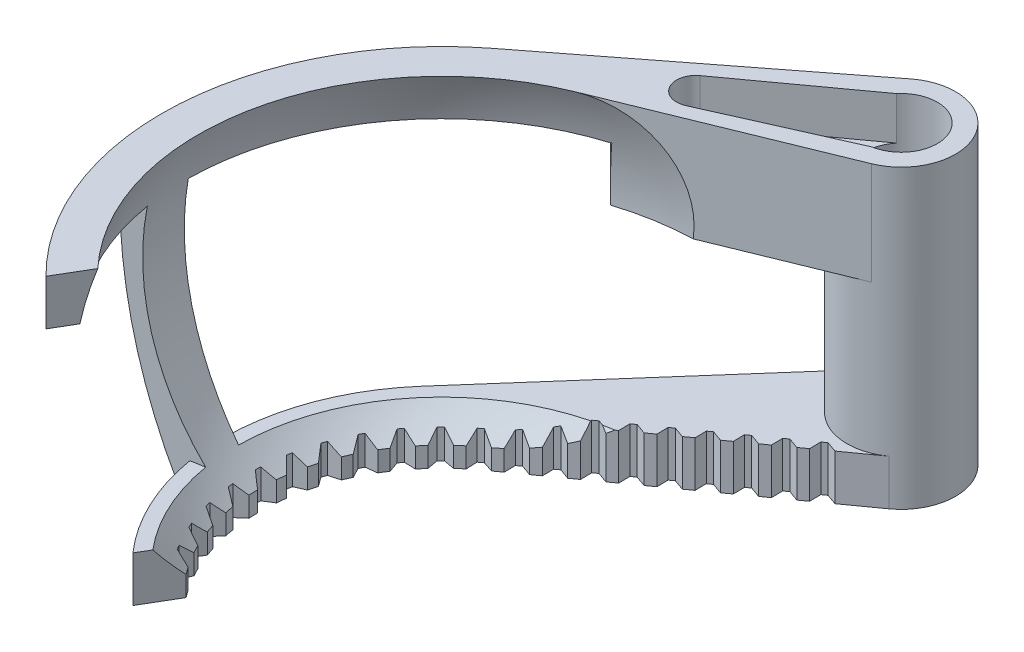
from build123d import *
from build123d.topology import SkipClean

# Parameters (mm, degrees)
BOSS_EXTRUDE1_START       = -4.7
BOSS_EXTRUDE1_DEPTH       = 4.7
BOSS_EXTRUDE2_OUTLINE_R   = 0.75
BOSS_EXTRUDE2_OUTLINE_R_2 = 2.5
BOSS_EXTRUDE2_DEPTH       = 0.3
SKETCH1_9_R               = 3.95
CUT_EXTRUDE2_DEPTH        = 0.7
SKETCH6_R                 = 0.75
SKETCH6_R_2               = 3.95
BOSS_EXTRUDE6_DEPTH       = 6.25
BOSS_EXTRUDE3_START       = 6.25
SKETCH2_R                 = 5.95
SKETCH2_R_2               = 4.2
BOSS_EXTRUDE3_DEPTH       = 16.25
SKETCH4_R                 = 5.95
SKETCH4_R_2               = 4.2
BOSS_EXTRUDE5_DEPTH       = 5
REVOLVE1_ANGLE            = 10
CUT_EXTRUDE3_DEPTH        = 79.445410831
CIRPATTERN1_COUNT         = 11
CIRPATTERN1_ANGLE         = 85
CUT_EXTRUDE4_DEPTH        = 79.445410831
LPATTERN1_COUNT           = 9
LPATTERN1_PITCH           = 3


# Read off the part's stored shape, not the designer's step: Boss-Extrude2
with BuildPart() as part:
    # Sketch1 → Boss-Extrude1 (new body)
    with BuildSketch(Plane.XZ.offset(-23.543068193).offset(BOSS_EXTRUDE1_START)):
        with BuildLine():
            Line((-0.472592015, 60.640230135), (-2.578285997, 64.210446846))
            ThreePointArc((-2.578285997, 64.210446846), (-11.633365316, 40.543634759), (0.19757138, 18.135123145))
            Line((0.19757138, 18.135123145), (26.104084692, -1.947430003))
            ThreePointArc((26.104084692, -1.947430003), (34.902992649, -0.218708783), (31.996731648, 8.264386483))
            Line((31.996731648, 8.264386483), (8.919209653, 17.677874535))
            ThreePointArc((8.919209653, 17.677874535), (-7.073200942, 36.689574632), (-0.472592015, 60.640230135))
        make_face()
        with BuildLine():
            ThreePointArc((14.223692018, 9.302922077), (13.639231125, 12.051374585), (16.311289521, 12.920678706))
            Line((16.311289521, 12.920678706), (30.419933466, 6.647779521))
            ThreePointArc((30.419933466, 6.647779521), (32.770289273, 5.300105007), (33.699453705, 2.75509961))
            ThreePointArc((33.699453705, 2.75509961), (31.093930231, -0.959046708), (26.714702885, 0.226703387))
            Line((26.714702885, 0.226703387), (14.223692018, 9.302922077))
        make_face(mode=Mode.SUBTRACT)
    extrude(amount=BOSS_EXTRUDE1_DEPTH)

    # Boss-Extrude2 outline → Boss-Extrude2 (add)
    with BuildSketch(Plane.XZ.offset(-23.543068193)):
        with BuildLine():
            Line((-0.472592015, 60.640230135), (-2.578285997, 64.210446846))
            ThreePointArc((-2.578285997, 64.210446846), (-11.633365316, 40.543634759), (0.19757138, 18.135123145))
            Line((0.19757138, 18.135123145), (26.104084692, -1.947430003))
            ThreePointArc((26.104084692, -1.947430003), (34.902992649, -0.218708783), (31.996731648, 8.264386483))
            Line((31.996731648, 8.264386483), (8.919209653, 17.677874535))
            ThreePointArc((8.919209653, 17.677874535), (-7.073200942, 36.689574632), (-0.472592015, 60.640230135))
        make_face()
        with Locations((15.025056724, 11.251695017)):
            Circle(BOSS_EXTRUDE2_OUTLINE_R, mode=Mode.SUBTRACT)
        with Locations((16.757338721, 10.252095558)):
            Circle(BOSS_EXTRUDE2_OUTLINE_R, mode=Mode.SUBTRACT)
        with Locations((18.489620719, 9.252496098)):
            Circle(BOSS_EXTRUDE2_OUTLINE_R, mode=Mode.SUBTRACT)
        with Locations((20.221902717, 8.252896638)):
            Circle(BOSS_EXTRUDE2_OUTLINE_R, mode=Mode.SUBTRACT)
        with Locations((21.954184715, 7.253297178)):
            Circle(BOSS_EXTRUDE2_OUTLINE_R, mode=Mode.SUBTRACT)
        with Locations((23.686466713, 6.253697719)):
            Circle(BOSS_EXTRUDE2_OUTLINE_R, mode=Mode.SUBTRACT)
        with Locations((29.749453705, 2.75509961)):
            Circle(BOSS_EXTRUDE2_OUTLINE_R_2, mode=Mode.SUBTRACT)
        with Locations((25.418748711, 5.254098259)):
            Circle(BOSS_EXTRUDE2_OUTLINE_R, mode=Mode.SUBTRACT)
    extrude(amount=BOSS_EXTRUDE2_DEPTH)

    # Sketch1<9> → Cut-Extrude2 (cut)
    with SkipClean():  # the faces are left unmerged after this step: merging them gives an invalid solid
        with BuildSketch(Plane.XZ.offset(-23.543068193)):
            with Locations(Location((29.749453705, 2.75509961, 0), (0, 0, 270))):
                Circle(SKETCH1_9_R)
        extrude(amount=CUT_EXTRUDE2_DEPTH, mode=Mode.SUBTRACT)

    # Sketch6 → Boss-Extrude6 (add)
    with SkipClean():  # the faces are left unmerged after this step: merging them gives an invalid solid
        with BuildSketch(Plane.XZ.offset(-23.243068193)):
            with BuildLine():
                Line((31.996731648, 8.264386483), (13.649275404, 15.748446521))
                ThreePointArc((13.649275404, 15.748446521), (9.622827675, 14.369008044), (10.443354312, 10.192661811))
                Line((10.443354312, 10.192661811), (26.104084692, -1.947430003))
                ThreePointArc((26.104084692, -1.947430003), (34.902992649, -0.218708783), (31.996731648, 8.264386483))
            make_face()
            with Locations((15.025056724, 11.251695017)):
                Circle(SKETCH6_R, mode=Mode.SUBTRACT)
            with Locations((16.757338721, 10.252095558)):
                Circle(SKETCH6_R, mode=Mode.SUBTRACT)
            with Locations((18.489620719, 9.252496098)):
                Circle(SKETCH6_R, mode=Mode.SUBTRACT)
            with Locations((20.221902717, 8.252896638)):
                Circle(SKETCH6_R, mode=Mode.SUBTRACT)
            with Locations((21.954184715, 7.253297178)):
                Circle(SKETCH6_R, mode=Mode.SUBTRACT)
            with Locations((23.686466713, 6.253697719)):
                Circle(SKETCH6_R, mode=Mode.SUBTRACT)
            with Locations((29.749453705, 2.75509961)):
                Circle(SKETCH6_R_2, mode=Mode.SUBTRACT)
            with Locations((25.418748711, 5.254098259)):
                Circle(SKETCH6_R, mode=Mode.SUBTRACT)
        extrude(amount=BOSS_EXTRUDE6_DEPTH)

    # Sketch2 → Boss-Extrude3 (add)
    with SkipClean():  # the faces are left unmerged after this step: merging them gives an invalid solid
        with BuildSketch(Plane.XZ.offset(-23.243068193).offset(BOSS_EXTRUDE3_START)):
            with Locations(Location((29.749453705, 2.75509961, 0), (0, 0, 232.217400312))):
                Circle(SKETCH2_R)
            with Locations((29.749453705, 2.75509961)):
                Circle(SKETCH2_R_2, mode=Mode.SUBTRACT)
        extrude(amount=BOSS_EXTRUDE3_DEPTH)

    # Sketch4 → Boss-Extrude5 (add)
    # profile 1 of 2: a face of its own
    with SkipClean():  # the faces are left unmerged after this step: merging them gives an invalid solid
        with BuildSketch(Plane.XZ.offset(-0.743068193)):
            with Locations(Location((29.749453705, 2.75509961, 0), (0, 0, 232.217400312))):
                Circle(SKETCH4_R)
            with Locations((29.749453705, 2.75509961)):
                Circle(SKETCH4_R_2, mode=Mode.SUBTRACT)
        # profile 2 of 2: a face of its own
        with BuildSketch(Plane.XZ.offset(-0.743068193)):
            with BuildLine():
                Line((33.215886618, 7.59104242), (7.347230343, 26.133850933))
                ThreePointArc((7.347230343, 26.133850933), (-0.783193574, 39.446224983), (3.120108256, 54.548785387))
                Line((3.120108256, 54.548785387), (0.957208419, 58.215994967))
                ThreePointArc((0.957208419, 58.215994967), (-5.00089426, 42.390828737), (0.954956103, 26.564814703))
                Line((0.954956103, 26.564814703), (25.27600829, -1.168009631))
                ThreePointArc((25.27600829, -1.168009631), (25.34107909, 6.751189354), (33.215886618, 7.59104242))
            make_face()
        extrude(amount=BOSS_EXTRUDE5_DEPTH)

    # Sketch5 → Cut-Revolve1 (revolve, cut)
    with SkipClean():  # the faces are left unmerged after this step: merging them gives an invalid solid
        with BuildSketch(Plane(origin=(7.392091837, 0, 44.324832913), x_dir=(-0.9863772479069666, 0, 0.1644990115820723), z_dir=(-0.1644990115820723, 1.1589156336199524e-15, -0.9863772479069666))):
            with BuildLine():
                ThreePointArc((16.732682915, 18.243068193), (8.385226178, 38.395611457), (-11.767317085, 46.743068193))
                Line((-11.767317085, 46.743068193), (-11.767317085, -10.256931807))
                ThreePointArc((-11.767317085, -10.256931807), (8.385226178, -1.909475071), (16.732682915, 18.243068193))
            make_face()
            with BuildLine():
                Line((-11.767317085, -10.256931807), (-11.767317085, 46.743068193))
                ThreePointArc((-11.767317085, 46.743068193), (-40.267317085, 18.243068193), (-11.767317085, -10.256931807))
            make_face()
        revolve(axis=Axis((18.999105679, 46.743068193, 42.389120883), (0, -1, 0)), mode=Mode.SUBTRACT)

    # Sketch9 → Revolve1 (revolve)
    with SkipClean():  # the faces are left unmerged after this step: merging them gives an invalid solid
        with BuildSketch(Plane(origin=(71.492081558, 0, 33.634820573), x_dir=(0.9863772479069666, 0, -0.1644990115820723), z_dir=(0.1644990115820723, -1.1589156336199524e-15, 0.9863772479069666))):
            with BuildLine():
                Line((-81.275926524, 23.243068193), (-83.905963121, 23.243068193))
                ThreePointArc((-83.905963121, 23.243068193), (-82.209941974, 9.092277505), (-77.21795083, -4.256931807))
                Line((-77.21795083, -4.256931807), (-77.21795083, 0.743068193))
                Line((-77.21795083, 0.743068193), (-75.712394589, 0.743068193))
                ThreePointArc((-75.712394589, 0.743068193), (-80.884704852, 11.401962881), (-81.275926524, 23.243068193))
            make_face()
        revolve(axis=Axis((18.999105679, 28.243068193, 42.389120883), (0, -1, 0)), revolution_arc=REVOLVE1_ANGLE)

    # Sketch11 → Cut-Extrude3 (cut, through all)
    with SkipClean():  # the faces are left unmerged after this step: merging them gives an invalid solid
        with BuildSketch(Plane(origin=(0, 0.743068193, 0), x_dir=(1, 0, 0), z_dir=(0, 1, 0))):
            with BuildLine():
                Line((2.532163802, -53.739884083), (1.289632269, -53.675154355))
                ThreePointArc((1.289632269, -53.675154355), (1.137086791, -53.432140455), (0.987875796, -53.187065043))
                Line((0.987875796, -53.187065043), (1.485316335, -52.046614493))
                ThreePointArc((1.485316335, -52.046614493), (1.987659119, -52.90628238), (2.532163802, -53.739884083))
            make_face()
        cut_extrude3 = extrude(amount=-CUT_EXTRUDE3_DEPTH, mode=Mode.SUBTRACT)

    # CirPattern1: Cut-Extrude3 ×11 about axis
    with SkipClean():  # the faces are left unmerged after this step: merging them gives an invalid solid
        cirpattern1_axis = Axis((18.999105679, 0, 42.389120883), (0, -1, 0))
        for i in range(1, CIRPATTERN1_COUNT):
            add(cut_extrude3.rotate(cirpattern1_axis, i * CIRPATTERN1_ANGLE / (CIRPATTERN1_COUNT - 1)), mode=Mode.SUBTRACT)

    # Sketch13 → Cut-Extrude4 (cut, through all)
    with SkipClean():  # the faces are left unmerged after this step: merging them gives an invalid solid
        with BuildSketch(Plane(origin=(0, 0.743068193, 0), x_dir=(1, 0, 0), z_dir=(0, 1, 0))):
            with BuildLine():
                Line((8.653671949, -25.197385727), (8.63358527, -23.953331438))
                ThreePointArc((8.63358527, -23.953331438), (8.865639921, -23.78458157), (9.099978501, -23.619017963))
                Line((9.099978501, -23.619017963), (10.271673933, -24.037592166))
                Line((10.271673933, -24.037592166), (8.653671949, -25.197385727))
            make_face()
        cut_extrude4 = extrude(amount=-CUT_EXTRUDE4_DEPTH, mode=Mode.SUBTRACT)

    # LPattern1: Cut-Extrude4 ×9
    with SkipClean():  # the faces are left unmerged after this step: merging them gives an invalid solid
        with Locations(*[Vector(0.8127634975154758, 0, -0.5825937667933044) * (i * LPATTERN1_PITCH) for i in range(1, LPATTERN1_COUNT)]):
            add(cut_extrude4, mode=Mode.SUBTRACT)


solid = part.part
